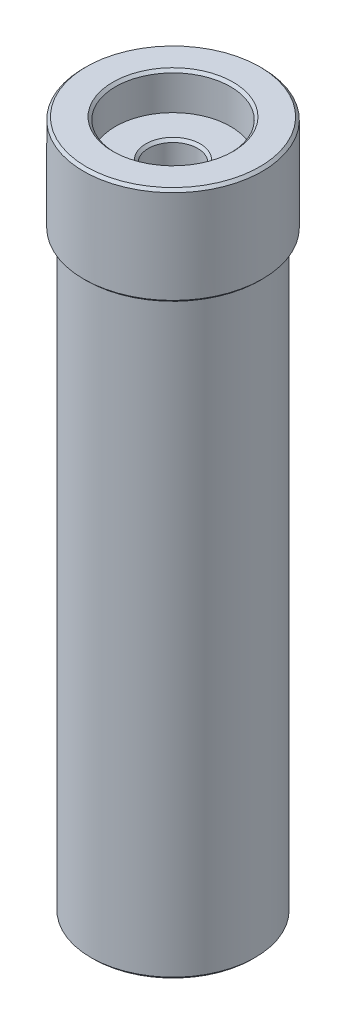
from build123d import *

# Parameters (mm, degrees)
SKETCH1_R                    = 15.875
BOSS_EXTRUDE1_DEPTH          = 114.3
SKETCH2_R                    = 17.272
BOSS_EXTRUDE2_DEPTH          = 19.05
F_1_12_TAPPED_HOLE2_D        = 23.41626
F_1_12_TAPPED_HOLE2_DEPTH    = 111.76
F_1_12_TAPPED_HOLE2_TIP      = 7.034954239
SKETCH10_R                   = 11.1125
CUT_EXTRUDE1_DEPTH           = 7.1628
F_3_8_0_375_DIAMETER_HOLE1_D = 9.525
CHAMFER2_SIZE                = 0.508


with BuildPart() as part:
    # Sketch1 → Boss-Extrude1 (new body)
    with BuildSketch(Plane(origin=(0, 0, 0), x_dir=(1, 0, 0), z_dir=(0, 1, 0))):
        Circle(SKETCH1_R)
    extrude(amount=BOSS_EXTRUDE1_DEPTH)

    # Sketch2 → Boss-Extrude2 (add)
    with BuildSketch(Plane(origin=(0, 114.3, 0), x_dir=(1, 0, 0), z_dir=(0, 1, 0))):
        Circle(SKETCH2_R)
    extrude(amount=BOSS_EXTRUDE2_DEPTH)

    # 1-12 Tapped Hole2
    with Locations(Plane(origin=(0, 0, 0), x_dir=(-1, 0, 0), z_dir=(0, -1, 0))):
        with Locations((0, 0)):
            Hole(F_1_12_TAPPED_HOLE2_D / 2, depth=F_1_12_TAPPED_HOLE2_DEPTH)
            with Locations((0, 0, -(F_1_12_TAPPED_HOLE2_DEPTH + F_1_12_TAPPED_HOLE2_TIP / 2))):  # 118° drill point
                Cone(0, F_1_12_TAPPED_HOLE2_D / 2, F_1_12_TAPPED_HOLE2_TIP, mode=Mode.SUBTRACT)

    # Sketch10 → Cut-Extrude1 (cut)
    with BuildSketch(Plane(origin=(0, 133.35, 0), x_dir=(1, 0, 0), z_dir=(0, 1, 0))):
        Circle(SKETCH10_R)
    extrude(amount=-CUT_EXTRUDE1_DEPTH, mode=Mode.SUBTRACT)

    # 3/8 (0.375) Diameter Hole1 (through all)
    with Locations(Plane(origin=(0, 126.1872, 0), x_dir=(1, 0, 0), z_dir=(0, 1, 0))):
        with Locations((0, 0)):
            Hole(F_3_8_0_375_DIAMETER_HOLE1_D / 2)

    # Chamfer2
    chamfer2_edges = [part.edges().sort_by_distance(p)[0] for p in [
        (-15.875, 0, 0),
        (-17.272, 114.3, 0),
        (-17.272, 133.35, 0),
        (4.7625, 126.1872, 0),
        (-11.1125, 133.35, 0),
    ]]
    chamfer(chamfer2_edges, length=CHAMFER2_SIZE)


solid = part.part
